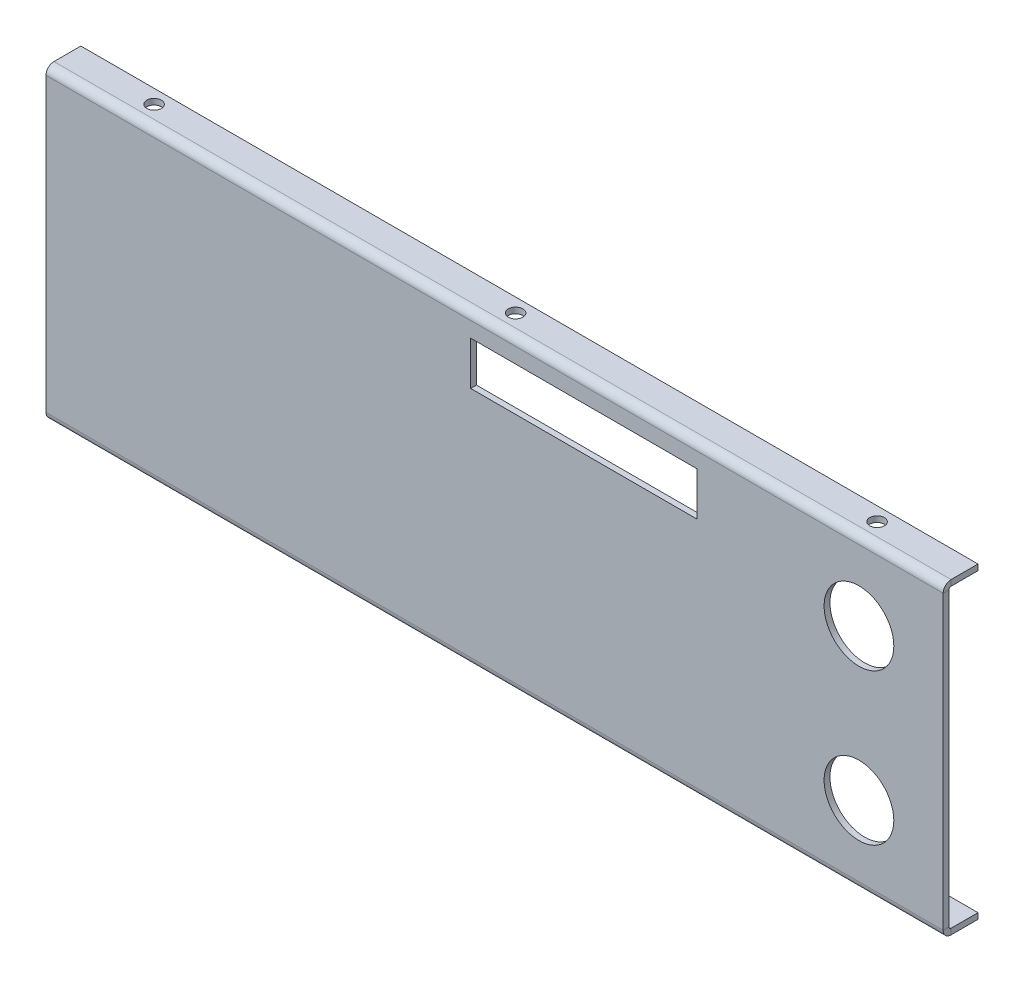
from build123d import *

# Parameters (mm, degrees)
SKETCH2_W                      = 309
SKETCH2_H                      = 106
BASE_FLANGE1_DEPTH             = 2
EDGE_FLANGE1_STRIP_W           = 9.4732
EDGE_FLANGE1_STRIP_H           = 2
EDGE_FLANGE1_STRIP_CUT_DEPTH   = 309
EDGE_FLANGE1_STRIP_2_W         = 9.4732
EDGE_FLANGE1_STRIP_2_H         = 2
EDGE_FLANGE1_STRIP_CUT_2_DEPTH = 309
EDGE_FLANGE1_DEPTH             = 309
EDGE_FLANGE1_BEND_DEPTH        = 309
CUT_EXTRUDE1_DEPTH             = 188.750499334
CUT_EXTRUDE1_DEPTH_BACK        = 188.750499334
SKETCH13_R                     = 12
CUT_EXTRUDE2_DEPTH             = 188.750499334
CUT_EXTRUDE2_DEPTH_BACK        = 188.750499334
SKETCH14_W                     = 78.027092835
SKETCH14_H                     = 15
CUT_EXTRUDE3_DEPTH             = 188.750499334
CUT_EXTRUDE3_DEPTH_BACK        = 188.750499334
SKETCH15_R                     = 2.5


# Sheet-metal steps are written as plain solids
with BuildPart() as part:
    # Sketch2 → Base-Flange1 (new body)
    with BuildSketch(Plane.XY):
        with Locations((0, 53)):
            Rectangle(SKETCH2_W, SKETCH2_H)
    extrude(amount=-BASE_FLANGE1_DEPTH)

    # Edge-Flange1 strip (across the edge) → Edge-Flange1 strip cut (cut)
    with BuildSketch(Plane(origin=(154.5, 0, -2), x_dir=(0, 1, 0), z_dir=(-1, 0, 0))):
        with Locations((-2, -1)):
            Rectangle(EDGE_FLANGE1_STRIP_W, EDGE_FLANGE1_STRIP_H)
    extrude(amount=EDGE_FLANGE1_STRIP_CUT_DEPTH, mode=Mode.SUBTRACT)

    # Edge-Flange1 strip 2 (across the edge) → Edge-Flange1 strip cut 2 (cut)
    with BuildSketch(Plane(origin=(-154.5, 106, -2), x_dir=(0, -1, 0), z_dir=(1, 0, 0))):
        with Locations((-2, -1)):
            Rectangle(EDGE_FLANGE1_STRIP_2_W, EDGE_FLANGE1_STRIP_2_H)
    extrude(amount=EDGE_FLANGE1_STRIP_CUT_2_DEPTH, mode=Mode.SUBTRACT)

    # Edge-Flange1 section (across the edge) → Edge-Flange1 (add)
    with BuildSketch(Plane(origin=(154.5, 0, -2), x_dir=(0, 1, 0), z_dir=(-1, 0, 0))):
        with BuildLine():
            Line((0, 0.7366), (0, 10))
            Line((0, 10), (2, 10))
            Line((2, 10), (2, 0.7366))
            ThreePointArc((2, 0.7366), (2.215745145, 0.215745145), (2.7366, 0))
            Line((2.7366, 0), (2.7366, -2))
            ThreePointArc((2.7366, -2), (0.801531583, -1.198468417), (0, 0.7366))
        make_face()
    extrude(amount=EDGE_FLANGE1_DEPTH)

    # Edge-Flange1 section 2 (across the edge) → Edge-Flange1 bend (add)
    with BuildSketch(Plane(origin=(-154.5, 106, -2), x_dir=(0, -1, 0), z_dir=(1, 0, 0))):
        with BuildLine():
            Line((0, 0.7366), (0, 10))
            Line((0, 10), (2, 10))
            Line((2, 10), (2, 0.7366))
            ThreePointArc((2, 0.7366), (2.215745145, 0.215745145), (2.7366, 0))
            Line((2.7366, 0), (2.7366, -2))
            ThreePointArc((2.7366, -2), (0.801531583, -1.198468417), (0, 0.7366))
        make_face()
    extrude(amount=EDGE_FLANGE1_BEND_DEPTH)

    # Sketch13 → Cut-Extrude1 (cut, two sides: drawn at the far end of the back side and taken through both)
    with BuildSketch(Plane.XY.offset(-CUT_EXTRUDE1_DEPTH_BACK)):
        with Locations((125.5, 79)):
            Circle(SKETCH13_R)
        with Locations((125.5, 27)):
            Circle(SKETCH13_R)
    extrude(amount=CUT_EXTRUDE1_DEPTH + CUT_EXTRUDE1_DEPTH_BACK, mode=Mode.SUBTRACT)

    # Sketch14 → Cut-Extrude2 (cut, two sides: drawn at the far end of the back side and taken through both)
    with BuildSketch(Plane.XY.offset(-CUT_EXTRUDE2_DEPTH_BACK)):
        with Locations((30.773130234, 90.5)):
            Rectangle(SKETCH14_W, SKETCH14_H)
    extrude(amount=CUT_EXTRUDE2_DEPTH + CUT_EXTRUDE2_DEPTH_BACK, mode=Mode.SUBTRACT)

    # Sketch15 → Cut-Extrude3 (cut, two sides: drawn at the far end of the back side and taken through both)
    with BuildSketch(Plane(origin=(0, 106, 0), x_dir=(1, 0, 0), z_dir=(0, 1, 0)).offset(-CUT_EXTRUDE3_DEPTH_BACK)):
        with Locations(Location((124.5, 7.2366, 0), (0, 0, 90))):
            Circle(SKETCH15_R)
        with Locations(Location((0, 7.2366, 0), (0, 0, 90))):
            Circle(SKETCH15_R)
        with Locations(Location((-124.5, 7.2366, 0), (0, 0, 90))):
            Circle(SKETCH15_R)
    extrude(amount=CUT_EXTRUDE3_DEPTH + CUT_EXTRUDE3_DEPTH_BACK, mode=Mode.SUBTRACT)


solid = part.part
